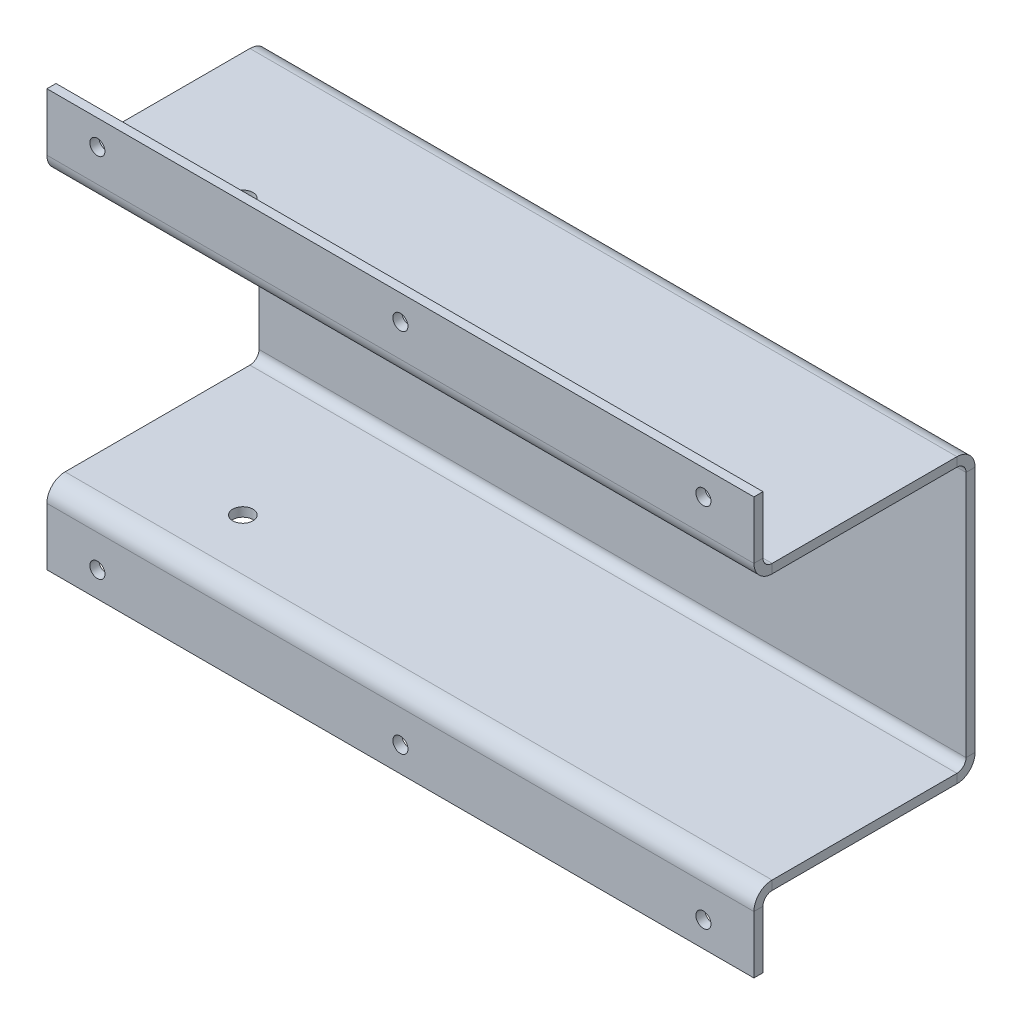
from build123d import *

# Parameters (mm, degrees)
BASE_FLANGE1_DEPTH           = 88.9
F_25_0_1495_DIAMETER_HOLE1_D = 3.7973
F_7_0_201_DIAMETER_HOLE1_D   = 5.1054


# Sheet-metal steps are written as plain solids
with BuildPart() as part:
    # Sketch1 → Base-Flange1 (new, symmetric)
    with BuildSketch(Plane.YZ):
        with BuildLine():
            Line((-52.3875, 26.67), (-37.9095, 26.67))
            ThreePointArc((-37.9095, 26.67), (-34.676607796, 25.330892204), (-33.3375, 22.098))
            Line((-33.3375, 22.098), (-33.3375, -24.384))
            ThreePointArc((-33.3375, -24.384), (-32.667946102, -26.000446102), (-31.0515, -26.67))
            Line((-31.0515, -26.67), (31.0515, -26.67))
            ThreePointArc((31.0515, -26.67), (32.667946102, -26.000446102), (33.3375, -24.384))
            Line((33.3375, -24.384), (33.3375, 22.098))
            ThreePointArc((33.3375, 22.098), (34.676607796, 25.330892204), (37.9095, 26.67))
            Line((37.9095, 26.67), (52.3875, 26.67))
            Line((52.3875, 26.67), (52.3875, 24.384))
            Line((52.3875, 24.384), (37.9095, 24.384))
            ThreePointArc((37.9095, 24.384), (36.293053898, 23.714446102), (35.6235, 22.098))
            Line((35.6235, 22.098), (35.6235, -24.384))
            ThreePointArc((35.6235, -24.384), (34.284392204, -27.616892204), (31.0515, -28.956))
            Line((31.0515, -28.956), (-31.0515, -28.956))
            ThreePointArc((-31.0515, -28.956), (-34.284392204, -27.616892204), (-35.6235, -24.384))
            Line((-35.6235, -24.384), (-35.6235, 22.098))
            ThreePointArc((-35.6235, 22.098), (-36.293053898, 23.714446102), (-37.9095, 24.384))
            Line((-37.9095, 24.384), (-52.3875, 24.384))
            Line((-52.3875, 24.384), (-52.3875, 26.67))
        make_face()
    extrude(amount=BASE_FLANGE1_DEPTH, both=True)

    # #25 (0.1495) Diameter Hole1 (through all)
    with Locations(Plane.XY.offset(26.67)):
        with Locations((-76.2, 46.0375), (0, 46.0375), (76.2, 46.0375), (76.2, -46.0375), (0, -46.0375), (-76.2, -46.0375)):
            Hole(F_25_0_1495_DIAMETER_HOLE1_D / 2)

    # #7 (0.201) Diameter Hole1 (through all)
    with Locations(Plane.XZ.offset(35.6235)):
        with Locations((-57.15, 9.144)):
            Hole(F_7_0_201_DIAMETER_HOLE1_D / 2)


solid = part.part
